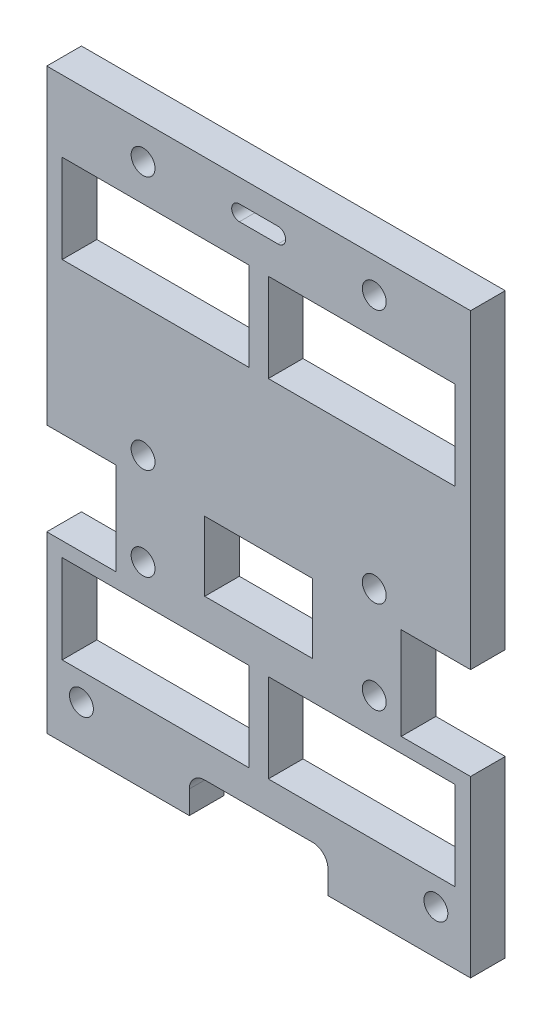
from build123d import *

# Parameters (mm, degrees)
SKETCH1_W                 = 55
SKETCH1_H                 = 75
SKETCH1_W_2               = 24.25
SKETCH1_H_2               = 11.5
BOSS_EXTRUDE1_DEPTH       = 4.5
SKETCH2_R                 = 1.55
SCREWHOLES_DEPTH          = 47.719910103
SKETCH5_R                 = 1.55
SKETCH5_W                 = 4.7
SKETCH5_H                 = 10.2
BRACETABS_DEPTH           = 47.719910103
SKETCH8_R                 = 1.55
EXPANSIONSCREWHOLES_DEPTH = 47.719910103
CABLETIESLOT_DEPTH        = 47.719910103
SKETCH11_W                = 18
SKETCH11_H                = 12
CUT_EXTRUDE2_DEPTH        = 47.719910103
SKETCH9_W                 = 18
SKETCH9_H                 = 5
REARFANSLOT_DEPTH         = 47.719910103
SKETCH13_W                = 14
SKETCH13_H                = 9
CUT_EXTRUDE3_DEPTH        = 47.719910103


with BuildPart() as part:
    # Sketch1 → Boss-Extrude1 (new body)
    with BuildSketch(Plane.XY):
        Rectangle(SKETCH1_W, SKETCH1_H)
        with Locations((-13.375, 22.5)):
            Rectangle(SKETCH1_W_2, SKETCH1_H_2, mode=Mode.SUBTRACT)
        with Locations((13.375, 22.5)):
            Rectangle(SKETCH1_W_2, SKETCH1_H_2, mode=Mode.SUBTRACT)
        with Locations((13.375, -22.5)):
            Rectangle(SKETCH1_W_2, SKETCH1_H_2, mode=Mode.SUBTRACT)
        with Locations((-13.375, -22.5)):
            Rectangle(SKETCH1_W_2, SKETCH1_H_2, mode=Mode.SUBTRACT)
    extrude(amount=BOSS_EXTRUDE1_DEPTH)

    # Sketch2 → screwHoles (cut, through all)
    with BuildSketch(Plane.XY.offset(4.5)):
        with Locations((-15, 33)):
            Circle(SKETCH2_R)
        with Locations((15, 33)):
            Circle(SKETCH2_R)
        with Locations((15, 0)):
            Circle(SKETCH2_R)
        with Locations((-15, 0)):
            Circle(SKETCH2_R)
    extrude(amount=-SCREWHOLES_DEPTH, mode=Mode.SUBTRACT)

    # Sketch5 → BraceTabs (cut, through all)
    with BuildSketch(Plane.XY.offset(4.5)):
        with Locations((23, -31.75)):
            Circle(SKETCH5_R)
        with Locations((-23, -31.75)):
            Circle(SKETCH5_R)
        with Locations((23, -9.75)):
            Rectangle(SKETCH5_W, SKETCH5_H)
        with Locations((-23, -9.75)):
            Rectangle(SKETCH5_W, SKETCH5_H)
    extrude(amount=-BRACETABS_DEPTH, mode=Mode.SUBTRACT)

    # Sketch8 → ExpansionScrewholes (cut, through all)
    with BuildSketch(Plane.XY.offset(4.5)):
        with Locations((-15, -12)):
            Circle(SKETCH8_R)
        with Locations((15, -12)):
            Circle(SKETCH8_R)
    extrude(amount=-EXPANSIONSCREWHOLES_DEPTH, mode=Mode.SUBTRACT)

    # Sketch12 → CableTieSlot (cut, through all)
    with BuildSketch(Plane.XY.offset(4.5)):
        with BuildLine():
            Line((-2.5, 34.5), (2.5, 34.5))
            ThreePointArc((2.5, 34.5), (3.5, 33.5), (2.5, 32.5))
            Line((2.5, 32.5), (-2.5, 32.5))
            ThreePointArc((-2.5, 32.5), (-3.5, 33.5), (-2.5, 34.5))
        make_face()
    extrude(amount=-CABLETIESLOT_DEPTH, mode=Mode.SUBTRACT)

    # Sketch11 → Cut-Extrude2 (cut, through all)
    with BuildSketch(Plane.XY.offset(4.5)):
        with Locations((27.5, -8.85)):
            Rectangle(SKETCH11_W, SKETCH11_H)
        with Locations((-27.5, -8.85)):
            Rectangle(SKETCH11_W, SKETCH11_H)
    extrude(amount=-CUT_EXTRUDE2_DEPTH, mode=Mode.SUBTRACT)

    # Sketch9 → RearFanSlot (cut, through all)
    with BuildSketch(Plane.XY.offset(4.5)):
        with BuildLine():
            Line((-9, -34.5), (-9, -37.5))
            Line((-9, -37.5), (9, -37.5))
            Line((9, -37.5), (9, -34.5))
            ThreePointArc((9, -34.5), (8.414213562, -33.085786438), (7, -32.5))
            Line((7, -32.5), (-7, -32.5))
            ThreePointArc((-7, -32.5), (-8.414213562, -33.085786438), (-9, -34.5))
        make_face()
        with Locations((0, -40)):
            Rectangle(SKETCH9_W, SKETCH9_H)
    extrude(amount=-REARFANSLOT_DEPTH, mode=Mode.SUBTRACT)

    # Sketch13 → Cut-Extrude3 (cut, through all)
    with BuildSketch(Plane.XY.offset(4.5)):
        with Locations((0, -7.35)):
            Rectangle(SKETCH13_W, SKETCH13_H)
    extrude(amount=-CUT_EXTRUDE3_DEPTH, mode=Mode.SUBTRACT)


solid = part.part
